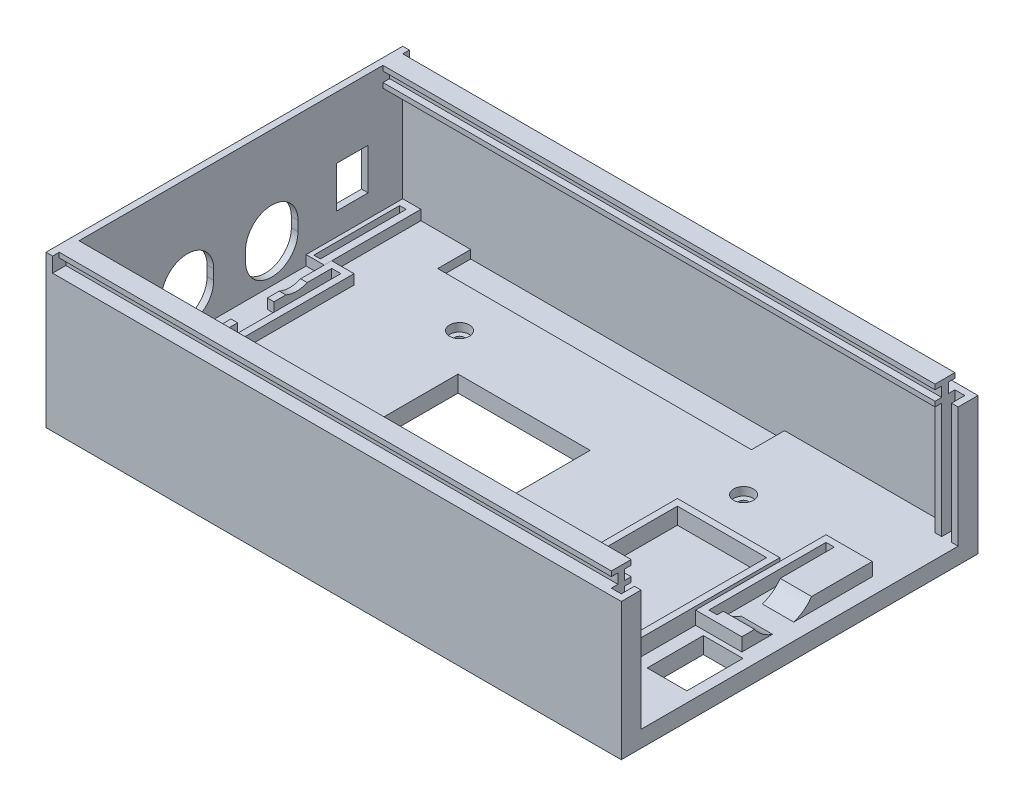
from build123d import *

# Parameters (mm, degrees)
SKETCH_1_W           = 174.15
SKETCH_1_H           = 108
EXTRUDE_1_DEPTH      = 63
SKETCH_2_W           = 104
SKETCH_2_H           = 56
CUT_EXTRUDE_1_DEPTH  = 172.15
SKETCH_3_W           = 174.15
SKETCH_3_H           = 108
CUT_EXTRUDE_2_DEPTH  = 2
CUT_EXTRUDE_3_DEPTH  = 10
SKETCH_4_W           = 6.75
SKETCH_4_H           = 50
SKETCH_4_W_2         = 2.75
SKETCH_4_H_2         = 46
EXTRUDE_2_DEPTH      = 3
SKETCH_6_R           = 7.94
CUT_EXTRUDE_4_DEPTH  = 3
SKETCH_7_W           = 11
SKETCH_7_H           = 3
CUT_EXTRUDE_5_DEPTH  = 3
SKETCH_13_W          = 6.5
SKETCH_13_H          = 39.5
SKETCH_13_W_2        = 2.5
SKETCH_13_H_2        = 35.5
EXTRUDE_5_DEPTH      = 4
SKETCH_14_W          = 39.5
SKETCH_14_H          = 4
EXTRUDE_6_DEPTH      = 12.5
CUT_EXTRUDE_9_DEPTH  = 14.5
SKETCH_16_R          = 1.45
SKETCH_16_W          = 12
SKETCH_16_H          = 17
CUT_EXTRUDE_10_DEPTH = 5
SKETCH_17_R          = 3
CUT_EXTRUDE_11_DEPTH = 2.5
EXTRUDE_7_DEPTH      = 5
SKETCH_20_W          = 9.597876209
SKETCH_20_H          = 5
CUT_EXTRUDE_13_DEPTH = 5
SKETCH_22_W          = 174.15
SKETCH_22_H          = 108
CUT_EXTRUDE_14_DEPTH = 15
SKETCH_29_W          = 40
SKETCH_29_H          = 40
CUT_EXTRUDE_21_DEPTH = 5
SKETCH_30_W          = 95
SKETCH_30_H          = 10
CUT_EXTRUDE_22_DEPTH = 2.5
SKETCH_36_W          = 172.15
SKETCH_36_H          = 6
EXTRUDE_12_DEPTH     = 6
CUT_EXTRUDE_START    = -174.15
CUT_EXTRUDE_27_DEPTH = 174.15
SKETCH_38_W          = 88
SKETCH_38_H          = 4.5
CUT_EXTRUDE_28_DEPTH = 10
SKETCH_41_W          = 2
SKETCH_41_H          = 108
EXTRUDE_15_DEPTH     = 4.5
CUT_EXTRUDE_START_2  = -41
CUT_EXTRUDE_29_DEPTH = 41
SKETCH_43_W          = 2
SKETCH_43_H          = 35
EXTRUDE_17_DEPTH     = 4
SKETCH_44_W          = 2
SKETCH_44_H          = 35
EXTRUDE_18_DEPTH     = 4
SKETCH_48_W          = 9.5
SKETCH_48_H          = 12.5
CUT_EXTRUDE_30_DEPTH = 10
SKETCH_49_W          = 5.5
SKETCH_49_H          = 29.256745024
SKETCH_49_W_2        = 2
SKETCH_49_H_2        = 26
EXTRUDE_19_DEPTH     = 3
SKETCH_51_W          = 2
SKETCH_51_H          = 104
CUT_EXTRUDE_31_DEPTH = 4.5
SKETCH_52_W          = 2
SKETCH_52_H          = 35
EXTRUDE_20_DEPTH     = 4
SKETCH_53_W          = 2
SKETCH_53_H          = 35
EXTRUDE_21_DEPTH     = 4


# Read off the part's stored shape, not the designer's step: 컷-돌출29
with BuildPart() as part:
    # 스케치1 → 보스-돌출1 (new body)
    with BuildSketch(Plane(origin=(0, 0, 0), x_dir=(1, 0, 0), z_dir=(0, 1, 0))):
        Rectangle(SKETCH_1_W, SKETCH_1_H)
    extrude(amount=EXTRUDE_1_DEPTH)

    # 스케치2 → 컷-돌출1 (cut)
    with BuildSketch(Plane(origin=(87.075, 0, 0), x_dir=(0, 0, -1), z_dir=(1, 0, 0))):
        with Locations((0, 33)):
            Rectangle(SKETCH_2_W, SKETCH_2_H)
    extrude(amount=-CUT_EXTRUDE_1_DEPTH, mode=Mode.SUBTRACT)

    # 스케치3 → 컷-돌출2 (cut)
    with BuildSketch(Plane(origin=(0, 63, 0), x_dir=(1, 0, 0), z_dir=(0, 1, 0))):
        Rectangle(SKETCH_3_W, SKETCH_3_H)
    extrude(amount=-CUT_EXTRUDE_2_DEPTH, mode=Mode.SUBTRACT)

    # 스케치5 → 컷-돌출3 (cut)
    with BuildSketch(Plane.ZY.offset(87.075)):
        with BuildLine():
            Line((-20.28, 18.25), (-20.28, 15.25))
            ThreePointArc((-20.28, 15.25), (-12.34, 7.31), (-4.4, 15.25))
            Line((-4.4, 15.25), (-4.4, 18.25))
            ThreePointArc((-4.4, 18.25), (-12.34, 26.19), (-20.28, 18.25))
        make_face()
        with BuildLine():
            Line((5.22, 18.25), (5.22, 15.25))
            ThreePointArc((5.22, 15.25), (13.16, 7.31), (21.1, 15.25))
            Line((21.1, 15.25), (21.1, 18.25))
            ThreePointArc((21.1, 18.25), (13.16, 26.19), (5.22, 18.25))
        make_face()
    extrude(amount=-CUT_EXTRUDE_3_DEPTH, mode=Mode.SUBTRACT)

    # 스케치16 → 컷-돌출10 (cut)
    with BuildSketch(Plane(origin=(0, 0, 0), x_dir=(-1, 0, 0), z_dir=(0, -1, 0))):
        with Locations(Location((44.92609, -28.96802, 0), (0, 0, 90))):
            Circle(SKETCH_16_R)
        with Locations(Location((44.92629, 29.0311, 0), (0, 0, 90))):
            Circle(SKETCH_16_R)
        with Locations(Location((-41.07277, 29.03265, 0), (0, 0, 90))):
            Circle(SKETCH_16_R)
        with Locations(Location((-41.0739, -28.96784, 0), (0, 0, 90))):
            Circle(SKETCH_16_R)
        with Locations((-77.925, -22.5)):
            Rectangle(SKETCH_16_W, SKETCH_16_H)
    extrude(amount=-CUT_EXTRUDE_10_DEPTH, mode=Mode.SUBTRACT)

    # 스케치17 → 컷-돌출11 (cut)
    with BuildSketch(Plane(origin=(0, 5, 0), x_dir=(1, 0, 0), z_dir=(0, 1, 0))):
        with Locations(Location((-44.92629, 29.0311, 0), (0, 0, 270))):
            Circle(SKETCH_17_R)
        with Locations(Location((-44.92609, -28.96802, 0), (0, 0, 270))):
            Circle(SKETCH_17_R)
        with Locations(Location((41.07277, 29.03265, 0), (0, 0, 270))):
            Circle(SKETCH_17_R)
        with Locations(Location((41.0739, -28.96784, 0), (0, 0, 270))):
            Circle(SKETCH_17_R)
    extrude(amount=-CUT_EXTRUDE_11_DEPTH, mode=Mode.SUBTRACT)

    # 스케치22 → 컷-돌출14 (cut)
    with BuildSketch(Plane(origin=(0, 46, 0), x_dir=(1, 0, 0), z_dir=(0, 1, 0))):
        Rectangle(SKETCH_22_W, SKETCH_22_H)
    extrude(amount=CUT_EXTRUDE_14_DEPTH, mode=Mode.SUBTRACT)

    # 스케치29 → 컷-돌출21 (cut)
    with BuildSketch(Plane(origin=(0, 0, 0), x_dir=(-1, 0, 0), z_dir=(0, -1, 0))):
        with Locations((13.754205887, -2.580173459)):
            Rectangle(SKETCH_29_W, SKETCH_29_H)
    extrude(amount=-CUT_EXTRUDE_21_DEPTH, mode=Mode.SUBTRACT)

    # 스케치30 → 컷-돌출22 (cut)
    with BuildSketch(Plane(origin=(0, 5, 0), x_dir=(1, 0, 0), z_dir=(0, 1, 0))):
        with Locations((-17.002844683, 47)):
            Rectangle(SKETCH_30_W, SKETCH_30_H)
    extrude(amount=-CUT_EXTRUDE_22_DEPTH, mode=Mode.SUBTRACT)

    # 스케치36 → 보스-돌출12 (add)
    with BuildSketch(Plane(origin=(0, 46, 0), x_dir=(1, 0, 0), z_dir=(0, 1, 0))):
        with Locations((1, 49)):
            Rectangle(SKETCH_36_W, SKETCH_36_H)
        with Locations((1, -49)):
            Rectangle(SKETCH_36_W, SKETCH_36_H)
    extrude(amount=-EXTRUDE_12_DEPTH)

    # 스케치37 → 컷-돌출27 (cut)
    with BuildSketch(Plane(origin=(87.075, 0, 0), x_dir=(0, 0, -1), z_dir=(1, 0, 0)).offset(CUT_EXTRUDE_START)):
        Polygon((-46, 44.5), (-48, 44.5), (-48, 41.5), (-46, 41.5), (-44, 41.5), (-44, 46), (-46, 46), align=None)
        Polygon((-50, 44.5), (-50, 41.5), (-52, 41.5), (-54, 41.5), (-54, 46), (-52, 46), (-52, 44.5), align=None)
        Polygon((46, 44.5), (46, 46), (44, 46), (44, 41.5), (46, 41.5), (48, 41.5), (48, 44.5), align=None)
        Polygon((54, 41.5), (52, 41.5), (50, 41.5), (50, 44.5), (52, 44.5), (52, 46), (54, 46), align=None)
    extrude(amount=CUT_EXTRUDE_27_DEPTH, mode=Mode.SUBTRACT)

    # 스케치38 → 컷-돌출28 (cut)
    with BuildSketch(Plane.ZY.offset(87.075)):
        with Locations((0, 43.75)):
            Rectangle(SKETCH_38_W, SKETCH_38_H)
    extrude(amount=-CUT_EXTRUDE_28_DEPTH, mode=Mode.SUBTRACT)

    # 스케치41 → 보스-돌출15 (add)
    with BuildSketch(Plane(origin=(0, 41.5, 0), x_dir=(1, 0, 0), z_dir=(0, 1, 0))):
        with Locations((-86.075, 0)):
            Rectangle(SKETCH_41_W, SKETCH_41_H)
    extrude(amount=EXTRUDE_15_DEPTH)


with BuildPart() as body_2:
    # 스케치4 → 보스-돌출2 (new body)
    with BuildSketch(Plane(origin=(0, 5, 0), x_dir=(1, 0, 0), z_dir=(0, 1, 0))):
        with Locations((-76.2, 0)):
            Rectangle(SKETCH_4_W, SKETCH_4_H)
        with Locations((-76.2, 0)):
            Rectangle(SKETCH_4_W_2, SKETCH_4_H_2, mode=Mode.SUBTRACT)
    extrude(amount=EXTRUDE_2_DEPTH)

    # 스케치6 → 컷-돌출4 (cut)
    with BuildSketch(Plane.ZY.offset(79.575)):
        with Locations((-12.34, 15.25)):
            Circle(SKETCH_6_R)
        with Locations((13.16, 15.25)):
            Circle(SKETCH_6_R)
    extrude(amount=-CUT_EXTRUDE_4_DEPTH, mode=Mode.SUBTRACT)

    # 스케치7 → 컷-돌출5 (cut)
    with BuildSketch(Plane.ZY.offset(79.575)):
        with Locations((0, 6.5)):
            Rectangle(SKETCH_7_W, SKETCH_7_H)
    extrude(amount=-CUT_EXTRUDE_5_DEPTH, mode=Mode.SUBTRACT)


with BuildPart() as body_3:
    # 스케치13 → 보스-돌출5 (new body)
    with BuildSketch(Plane(origin=(0, 5, 0), x_dir=(1, 0, 0), z_dir=(0, 1, 0))):
        with Locations((71.325, 7.25)):
            Rectangle(SKETCH_13_W, SKETCH_13_H)
        with Locations((71.325, 7.25)):
            Rectangle(SKETCH_13_W_2, SKETCH_13_H_2, mode=Mode.SUBTRACT)
    extrude(amount=EXTRUDE_5_DEPTH)

    # 스케치14 → 보스-돌출6 (add)
    with BuildSketch(Plane(origin=(74.575, 0, 0), x_dir=(0, 0, -1), z_dir=(1, 0, 0))):
        with Locations((7.25, 7)):
            Rectangle(SKETCH_14_W, SKETCH_14_H)
    extrude(amount=EXTRUDE_6_DEPTH)

    # 스케치15 → 컷-돌출9 (cut)
    with BuildSketch(Plane(origin=(87.075, 0, 0), x_dir=(0, 0, -1), z_dir=(1, 0, 0))):
        with BuildLine():
            Line((8.61684397, 9), (-8.61684397, 9))
            ThreePointArc((-8.61684397, 9), (-6.23848384, 6.554212921), (-3.201562119, 5))
            Line((-3.201562119, 5), (3.201562119, 5))
            ThreePointArc((3.201562119, 5), (6.23848384, 6.554212921), (8.61684397, 9))
        make_face()
    extrude(amount=-CUT_EXTRUDE_9_DEPTH, mode=Mode.SUBTRACT)


with BuildPart() as body_4:
    # 스케치19 → 보스-돌출7 (new body)
    with BuildSketch(Plane(origin=(0, 5, 0), x_dir=(1, 0, 0), z_dir=(0, 1, 0))):
        with BuildLine():
            ThreePointArc((39.075, -31.204891361), (38.0739, -28.96784), (39.075, -26.730788639))
            Line((39.075, -26.730788639), (39.075, 11))
            Line((39.075, 11), (66.075, 11))
            Line((66.075, 11), (66.075, -52))
            Line((66.075, -52), (68.075, -52))
            Line((68.075, -52), (68.075, 13))
            Line((68.075, 13), (37.075, 13))
            Line((37.075, 13), (37.075, -52))
            Line((37.075, -52), (39.075, -52))
            Line((39.075, -52), (39.075, -31.204891361))
        make_face()
    extrude(amount=EXTRUDE_7_DEPTH)

    # 스케치20 → 컷-돌출13 (cut)
    with BuildSketch(Plane.ZY.offset(-37.075)):
        with Locations((20.951522743, 7.5)):
            Rectangle(SKETCH_20_W, SKETCH_20_H)
    extrude(amount=-CUT_EXTRUDE_13_DEPTH, mode=Mode.SUBTRACT)


with BuildPart() as cut_extrude_13_piece_1:
    # of the separate pieces the step leaves, piece 1, a body of its own (cut_extrude_13_pieces)
    add(body_4.part.solids().sort_by_distance((39.075, 5, 16.152584639))[0])


with BuildPart() as cut_extrude_13_piece_2:
    # of the separate pieces the step leaves, piece 2, a body of its own (cut_extrude_13_pieces)
    add(body_4.part.solids().sort_by_distance((39.075, 5, 31.204891361))[0])


with BuildPart() as cut_extrude_29_tool:
    # 컷-돌출29 outline → 컷-돌출29 (new body)
    with BuildSketch(Plane(origin=(0, 46, 0), x_dir=(1, 0, 0), z_dir=(0, 1, 0)).offset(CUT_EXTRUDE_START_2)):
        Polygon((85.075, 52), (82.075, 52), (82.075, -52), (85.075, -52), (85.075, -48), (87.075, -48), (87.075, 48), (85.075, 48), align=None)
    extrude(amount=CUT_EXTRUDE_29_DEPTH)


with BuildPart() as part_1:
    add(part.part)

    # 컷-돌출29: cut by cut_extrude_29_tool
    add(cut_extrude_29_tool.part, mode=Mode.SUBTRACT)

    # 스케치43 → 보스-돌출17 (add)
    with BuildSketch(Plane.XY.offset(-52)):
        with Locations((86.075, 22.5)):
            Rectangle(SKETCH_43_W, SKETCH_43_H)
    extrude(amount=EXTRUDE_17_DEPTH)

    # 스케치44 → 보스-돌출18 (add)
    with BuildSketch(Plane(origin=(0, 0, 52), x_dir=(-1, 0, 0), z_dir=(0, 0, -1))):
        with Locations((-86.075, 22.5)):
            Rectangle(SKETCH_44_W, SKETCH_44_H)
    extrude(amount=EXTRUDE_18_DEPTH)

    # 스케치48 → 컷-돌출30 (cut)
    with BuildSketch(Plane.ZY.offset(87.075)):
        with Locations((-36.757528825, 21.05)):
            Rectangle(SKETCH_48_W, SKETCH_48_H)
    extrude(amount=-CUT_EXTRUDE_30_DEPTH, mode=Mode.SUBTRACT)

    # 스케치51 → 컷-돌출31 (cut)
    with BuildSketch(Plane(origin=(0, 46, 0), x_dir=(1, 0, 0), z_dir=(0, 1, 0))):
        with Locations((86.075, 0)):
            Rectangle(SKETCH_51_W, SKETCH_51_H)
    extrude(amount=-CUT_EXTRUDE_31_DEPTH, mode=Mode.SUBTRACT)

    # 스케치52 → 보스-돌출20 (add)
    with BuildSketch(Plane.XY.offset(-52)):
        with Locations((81.075, 22.5)):
            Rectangle(SKETCH_52_W, SKETCH_52_H)
    extrude(amount=EXTRUDE_20_DEPTH)

    # 스케치53 → 보스-돌출21 (add)
    with BuildSketch(Plane(origin=(0, 0, 52), x_dir=(-1, 0, 0), z_dir=(0, 0, -1))):
        with Locations((-81.075, 22.5)):
            Rectangle(SKETCH_53_W, SKETCH_53_H)
    extrude(amount=EXTRUDE_21_DEPTH)


with BuildPart() as body_3_1:
    add(body_3.part)

    # 컷-돌출29: cut by cut_extrude_29_tool
    add(cut_extrude_29_tool.part, mode=Mode.SUBTRACT)


with BuildPart() as body_6:
    # 스케치49 → 보스-돌출19 (new body)
    with BuildSketch(Plane(origin=(0, 5, 0), x_dir=(1, 0, 0), z_dir=(0, 1, 0))):
        with Locations((-82.325, 37.369156313)):
            Rectangle(SKETCH_49_W, SKETCH_49_H)
        with Locations((-82.775, 36.757528825)):
            Rectangle(SKETCH_49_W_2, SKETCH_49_H_2, mode=Mode.SUBTRACT)
    extrude(amount=EXTRUDE_19_DEPTH)


solid = Compound([body_2.part, cut_extrude_13_piece_1.part, cut_extrude_13_piece_2.part, part_1.part, body_3_1.part, body_6.part])
